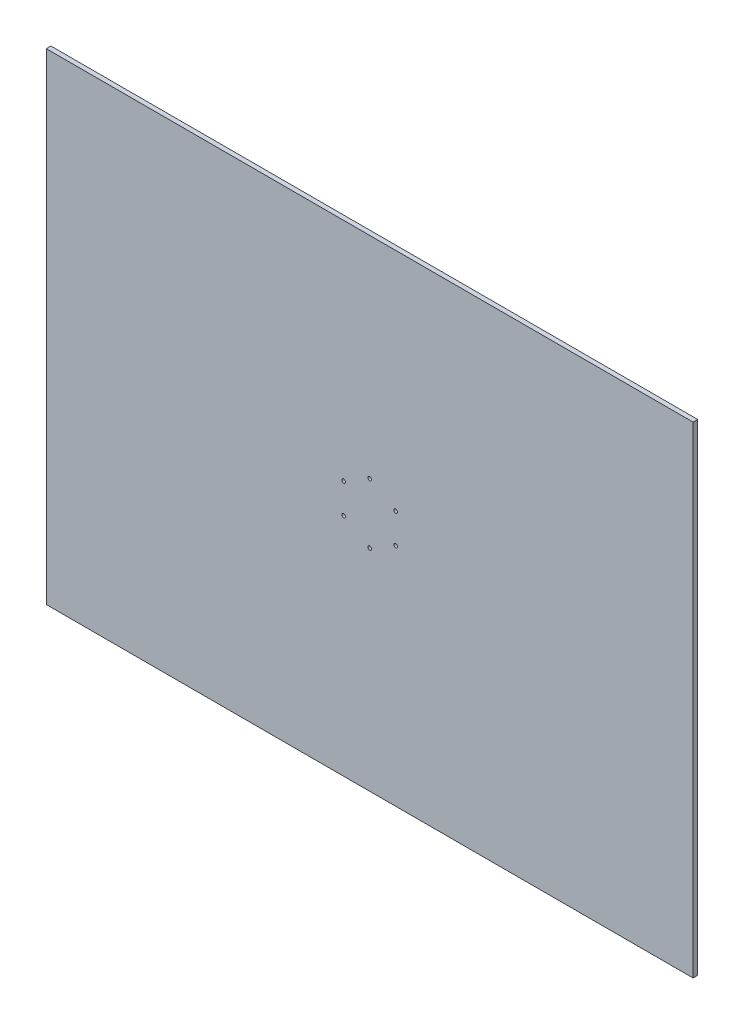
from build123d import *

# Parameters (mm, degrees)
SKETCH1_W           = 700
SKETCH1_H           = 521
BOSS_EXTRUDE1_DEPTH = 5
SKETCH2_R           = 2
CUT_EXTRUDE1_DEPTH  = 10


with BuildPart() as part:
    # Sketch1 → Boss-Extrude1 (new body)
    with BuildSketch(Plane.XY):
        with Locations((50, 0)):
            Rectangle(SKETCH1_W, SKETCH1_H)
    extrude(amount=BOSS_EXTRUDE1_DEPTH)

    # Sketch2 → Cut-Extrude1 (cut)
    with BuildSketch(Plane.XY.offset(5)):
        with Locations((50, 32.5)):
            Circle(SKETCH2_R)
        with Locations((78.145825623, 16.25)):
            Circle(SKETCH2_R)
        with Locations((78.145825623, -16.25)):
            Circle(SKETCH2_R)
        with Locations((50, -32.5)):
            Circle(SKETCH2_R)
        with Locations((21.854174377, -16.25)):
            Circle(SKETCH2_R)
        with Locations((21.854174377, 16.25)):
            Circle(SKETCH2_R)
    extrude(amount=-CUT_EXTRUDE1_DEPTH, mode=Mode.SUBTRACT)


solid = part.part
